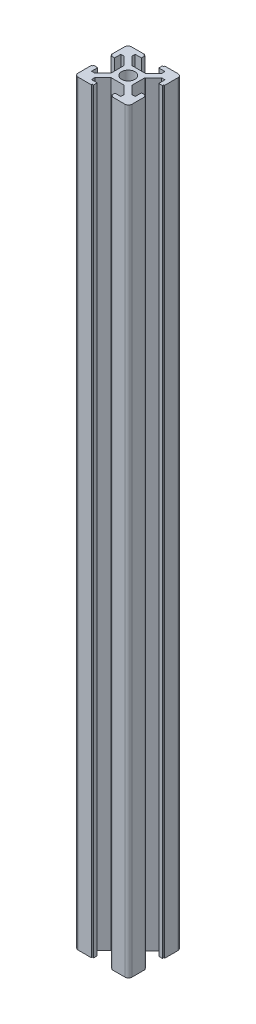
from build123d import *

# Parameters (mm, degrees)
SALIENTE_EXTRUIR1_START = -141.5
SALIENTE_EXTRUIR1_DEPTH = 283
CROQUIS2_R              = 2.5
CORTAR_EXTRUIR1_DEPTH   = 284.356342905


# Read off the part's stored shape, not the designer's step: Saliente-Extruir1
with BuildPart() as part:
    # Saliente-Extruir1 outline → Saliente-Extruir1 (new body)
    with BuildSketch(Plane(origin=(0, 0, 0), x_dir=(1, 0, 0), z_dir=(0, 1, 0)).offset(SALIENTE_EXTRUIR1_START)):
        with BuildLine():
            ThreePointArc((8.636410676, -9.909743891), (9.614405544, -9.524074441), (10, -8.546050003))
            Line((10, -8.546050003), (10, -3.656511811))
            Line((10, -3.656511811), (9.639909344, -3.656484199))
            Line((9.639909344, -3.656484199), (9.639947683, -3.156497817))
            Line((9.639947683, -3.156497817), (8.092374533, -3.156379149))
            Line((8.092374533, -3.156379149), (8.092195869, -5.486379142))
            Line((8.092195869, -5.486379142), (6.812195872, -5.486280992))
            Line((6.812195872, -5.486280992), (3.799920985, -2.474006104))
            Line((3.799920985, -2.474006104), (3.841542046, -2.432385043))
            Line((3.841542046, -2.432385043), (3.841542046, 2.432385043))
            Line((3.841542046, 2.432385043), (3.97749414, 2.474006104))
            Line((3.97749414, 2.474006104), (6.99, 5.486050003))
            Line((6.99, 5.486050003), (8.27, 5.486050003))
            Line((8.27, 5.486050003), (8.27, 3.156050003))
            Line((8.27, 3.156050003), (9.64, 3.156050003))
            Line((9.64, 3.156050003), (9.64, 3.656050003))
            Line((9.64, 3.656050003), (10, 3.656050003))
            Line((10, 3.656050003), (10, 8.546050003))
            ThreePointArc((10, 8.546050003), (9.645746662, 9.491640567), (8.726602194, 9.909743891))
            Line((8.726602194, 9.909743891), (3.746410661, 9.909743891))
            Line((3.746410661, 9.909743891), (3.746383085, 9.550118856))
            Line((3.746383085, 9.550118856), (3.246383087, 9.550157196))
            Line((3.246383087, 9.550157196), (3.246278035, 8.1801572))
            Line((3.246278035, 8.1801572), (5.576278029, 8.179978536))
            Line((5.576278029, 8.179978536), (5.576179878, 6.89997854))
            Line((5.576179878, 6.89997854), (2.563904991, 3.887703652))
            Line((2.563904991, 3.887703652), (2.386331835, 3.887703652))
            Line((2.386331835, 3.887703652), (2.371542046, 3.902385043))
            Line((2.371542046, 3.902385043), (-2.549115201, 3.902385043))
            Line((-2.549115201, 3.902385043), (-2.563904991, 3.887703652))
            Line((-2.563904991, 3.887703652), (-5.576179878, 6.89997854))
            Line((-5.576179878, 6.89997854), (-5.576278029, 8.179978536))
            Line((-5.576278029, 8.179978536), (-3.246278035, 8.1801572))
            Line((-3.246278035, 8.1801572), (-3.246383087, 9.550157196))
            Line((-3.246383087, 9.550157196), (-3.746383085, 9.550118856))
            Line((-3.746383085, 9.550118856), (-3.746410661, 9.909743891))
            Line((-3.746410661, 9.909743891), (-8.636410676, 9.909743891))
            ThreePointArc((-8.636410676, 9.909743891), (-9.581900138, 9.555487091), (-10, 8.636443724))
            Line((-10, 8.636443724), (-10, 3.656050003))
            Line((-10, 3.656050003), (-9.64, 3.656050003))
            Line((-9.64, 3.656050003), (-9.64, 3.156050003))
            Line((-9.64, 3.156050003), (-8.27, 3.156050003))
            Line((-8.27, 3.156050003), (-8.27, 5.486050003))
            Line((-8.27, 5.486050003), (-6.99, 5.486050003))
            Line((-6.99, 5.486050003), (-3.97749414, 2.474006104))
            Line((-3.97749414, 2.474006104), (-4.019115201, 2.432385043))
            Line((-4.019115201, 2.432385043), (-4.019115201, -2.432385043))
            Line((-4.019115201, -2.432385043), (-3.97749414, -2.474006104))
            Line((-3.97749414, -2.474006104), (-6.989769028, -5.486280992))
            Line((-6.989769028, -5.486280992), (-8.269769024, -5.486379142))
            Line((-8.269769024, -5.486379142), (-8.269947688, -3.156379149))
            Line((-8.269947688, -3.156379149), (-9.817520839, -3.156497817))
            Line((-9.817520839, -3.156497817), (-9.8174825, -3.656484199))
            Line((-9.8174825, -3.656484199), (-10.177573156, -3.656511811))
            Line((-10.177573156, -3.656511811), (-10.177573156, -8.546050003))
            ThreePointArc((-10.177573156, -8.546050003), (-9.7919787, -9.524074441), (-8.813983831, -9.909743891))
            Line((-8.813983831, -9.909743891), (-3.923983846, -9.910118855))
            Line((-3.923983846, -9.910118855), (-3.923956241, -9.550118856))
            Line((-3.923956241, -9.550118856), (-3.423956243, -9.550157196))
            Line((-3.423956243, -9.550157196), (-3.423851191, -8.1801572))
            Line((-3.423851191, -8.1801572), (-5.57627803, -8.179992152))
            Line((-5.57627803, -8.179992152), (-5.576179878, -6.89997854))
            Line((-5.576179878, -6.89997854), (-2.563904991, -3.887703652))
            Line((-2.563904991, -3.887703652), (-2.549115201, -3.902385043))
            Line((-2.549115201, -3.902385043), (2.371542046, -3.902385043))
            Line((2.371542046, -3.902385043), (2.386331835, -3.887703652))
            Line((2.386331835, -3.887703652), (5.398606723, -6.89997854))
            Line((5.398606723, -6.89997854), (5.398704874, -8.179992152))
            Line((5.398704874, -8.179992152), (3.246278035, -8.1801572))
            Line((3.246278035, -8.1801572), (3.246383087, -9.550157196))
            Line((3.246383087, -9.550157196), (3.746383085, -9.550118856))
            Line((3.746383085, -9.550118856), (3.74641069, -9.910118855))
            Line((3.74641069, -9.910118855), (8.636410676, -9.909743891))
        make_face()
    extrude(amount=SALIENTE_EXTRUIR1_DEPTH)

    # Croquis2 → Cortar-Extruir1 (cut, through all)
    with BuildSketch(Plane(origin=(0, 141.5, 0), x_dir=(1, 0, 0), z_dir=(0, 1, 0))):
        with Locations(Location((0, 0, 0), (0, 0, 270))):
            Circle(CROQUIS2_R)
    extrude(amount=-CORTAR_EXTRUIR1_DEPTH, mode=Mode.SUBTRACT)


solid = part.part
